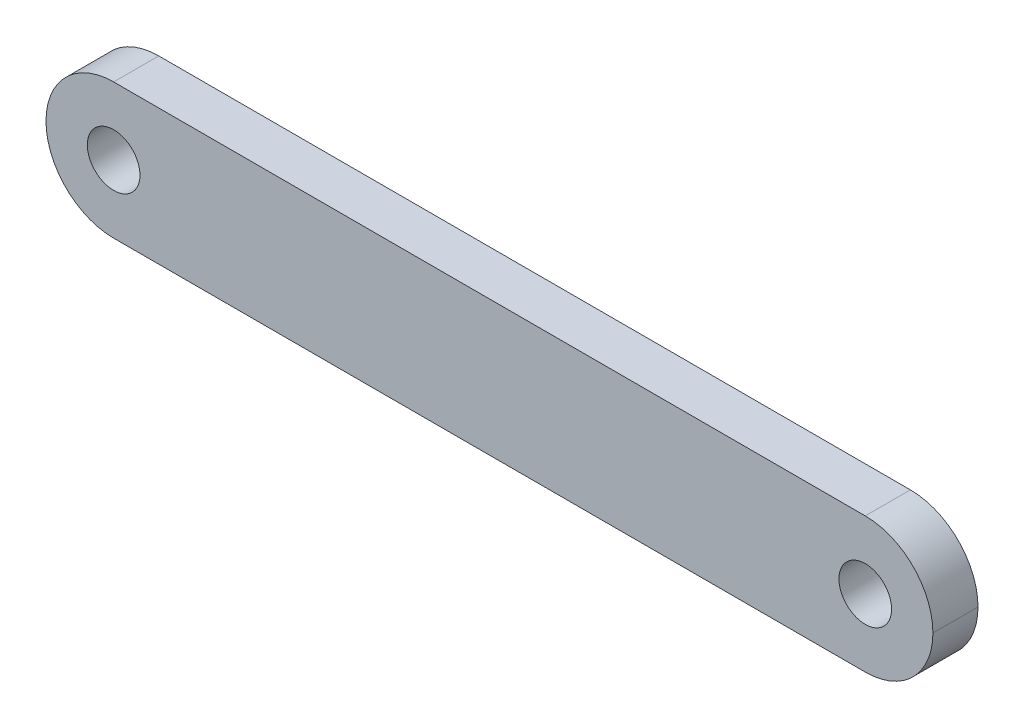
from build123d import *

# Parameters (mm, degrees)
ESQUISSE1_W        = 118
ESQUISSE1_H        = 18
ESQUISSE1_R        = 3.5
BOSS_EXTRU_1_DEPTH = 6
CONG_1_R           = 9


with BuildPart() as part:
    # Esquisse1 → Boss.-Extru.1 (new body)
    with BuildSketch(Plane.XY):
        with Locations((59, 9)):
            Rectangle(ESQUISSE1_W, ESQUISSE1_H)
        with Locations((9, 9)):
            Circle(ESQUISSE1_R, mode=Mode.SUBTRACT)
        with Locations(Location((109, 9, 0), (0, 0, 180))):
            Circle(ESQUISSE1_R, mode=Mode.SUBTRACT)
    extrude(amount=BOSS_EXTRU_1_DEPTH)

    # Congé1
    cong_1_edges = [part.edges().sort_by_distance(p)[0] for p in [
        (118, 18, 3),
        (118, 0, 3),
        (0, 0, 3),
        (0, 18, 3),
    ]]
    fillet(cong_1_edges, radius=CONG_1_R - 0.0001)  # a hair under: the kernel refuses the full size


solid = part.part
